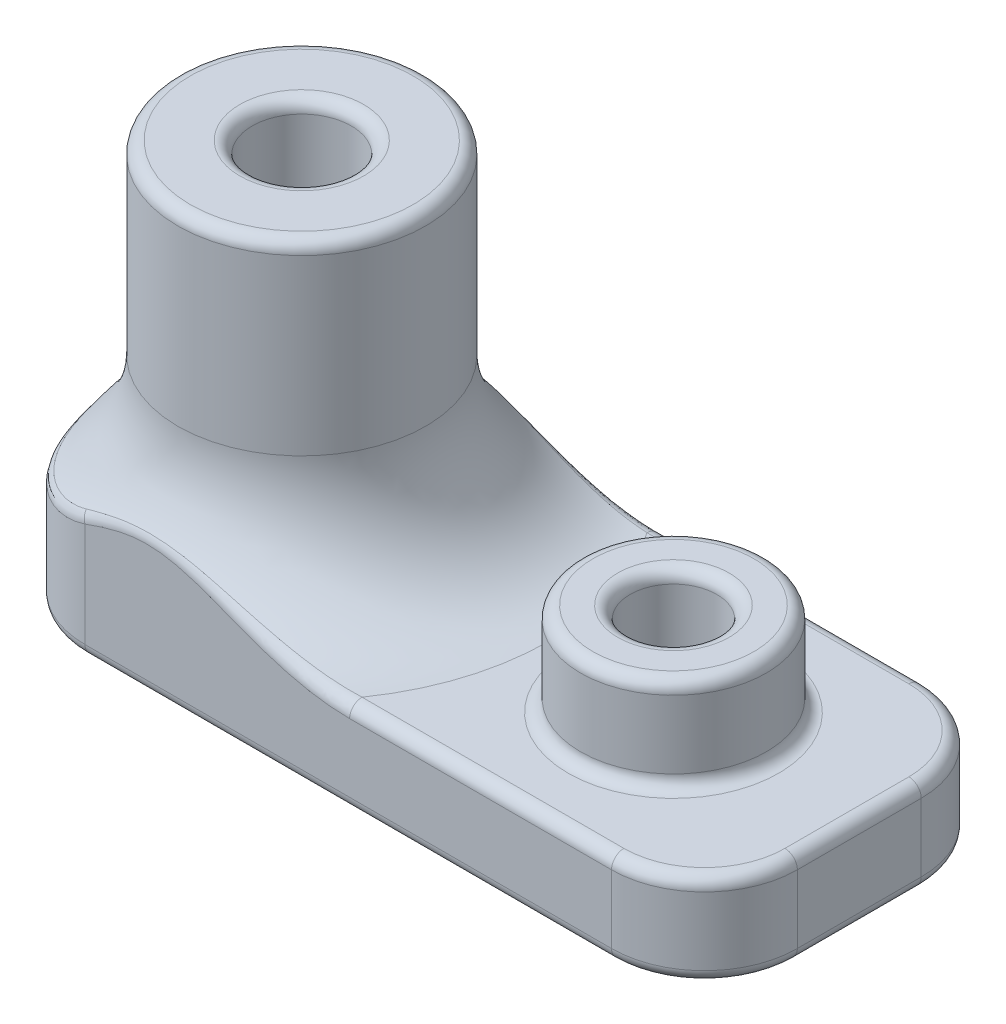
from build123d import *

# Parameters (mm, degrees)
SKETCH1_W           = 23
SKETCH1_H           = 10
BOSS_EXTRUDE1_DEPTH = 3
SKETCH2_R           = 4
BOSS_EXTRUDE2_DEPTH = 10
SKETCH3_R           = 1.6
CUT_EXTRUDE1_DEPTH  = 29.248893784
SKETCH4_R           = 1.4
CUT_EXTRUDE2_DEPTH  = 28
SKETCH5_R           = 2.85
CUT_EXTRUDE3_DEPTH  = 3
BOSS_EXTRUDE3_START = 3
SKETCH6_R           = 3
SKETCH6_R_2         = 1.4
BOSS_EXTRUDE3_DEPTH = 3
FILLET1_R           = 4
FILLET3_R           = 3
FILLET4_R           = 0.4
FILLET5_R           = 0.4


with BuildPart() as part:
    # Sketch1 → Boss-Extrude1 (new body)
    with BuildSketch(Plane(origin=(0, 0, 0), x_dir=(1, 0, 0), z_dir=(0, 1, 0))):
        with Locations((11.5, -5)):
            Rectangle(SKETCH1_W, SKETCH1_H)
    extrude(amount=BOSS_EXTRUDE1_DEPTH)

    # Sketch2 → Boss-Extrude2 (add)
    with BuildSketch(Plane(origin=(0, 3, 0), x_dir=(1, 0, 0), z_dir=(0, 1, 0))):
        with Locations(Location((5, -5, 0), (0, 0, 270))):
            Circle(SKETCH2_R)
    extrude(amount=BOSS_EXTRUDE2_DEPTH)

    # Sketch3 → Cut-Extrude1 (cut, through all)
    with BuildSketch(Plane(origin=(0, 13, 0), x_dir=(1, 0, 0), z_dir=(0, 1, 0))):
        with Locations(Location((5, -5, 0), (0, 0, 270))):
            Circle(SKETCH3_R)
    extrude(amount=-CUT_EXTRUDE1_DEPTH, mode=Mode.SUBTRACT)

    # Sketch4 → Cut-Extrude2 (cut, through all)
    with BuildSketch(Plane(origin=(0, 3, 0), x_dir=(1, 0, 0), z_dir=(0, 1, 0))):
        with Locations(Location((17, -5, 0), (0, 0, 270))):
            Circle(SKETCH4_R)
    extrude(amount=-CUT_EXTRUDE2_DEPTH, mode=Mode.SUBTRACT)

    # Sketch5 → Cut-Extrude3 (cut)
    with BuildSketch(Plane(origin=(0, 0, 0), x_dir=(-1, 0, 0), z_dir=(0, -1, 0))):
        with Locations(Location((-5, -5, 0), (0, 0, 90))):
            Circle(SKETCH5_R)
    extrude(amount=-CUT_EXTRUDE3_DEPTH, mode=Mode.SUBTRACT)

    # Sketch6 → Boss-Extrude3 (add)
    with BuildSketch(Plane(origin=(0, 3, 0), x_dir=(1, 0, 0), z_dir=(0, 1, 0)).offset(BOSS_EXTRUDE3_START)):
        with Locations(Location((17, -5, 0), (0, 0, 270))):
            Circle(SKETCH6_R)
        with Locations(Location((17, -5, 0), (0, 0, 270))):
            Circle(SKETCH6_R_2, mode=Mode.SUBTRACT)
    extrude(amount=-BOSS_EXTRUDE3_DEPTH)

    # Fillet1
    # the kernel refuses this fillet: 4 mm, written as the material it adds along each edge
    with BuildSketch(Plane(origin=(5, 3, 5), x_dir=(0, 0, 1), z_dir=(-1, 0, 0))) as fillet1_piece_1_section:
        with BuildLine():
            CenterArc((4 + FILLET1_R, FILLET1_R), FILLET1_R, 180, 90)
            Line((4, FILLET1_R), (4, 0))
            Line((4, 0), (4 + FILLET1_R, 0))
        make_face()
    fillet1_piece_1 = revolve(axis=Axis((5, 3, 5), (0, 1, 0)), mode=Mode.PRIVATE)
    fillet1_piece_1 = split(fillet1_piece_1, bisect_by=Plane(origin=(11.021245553, 3.091555609, 0), z_dir=(0, 0, 1)), keep=Keep.TOP, mode=Mode.PRIVATE)
    fillet1_piece_1 = split(fillet1_piece_1, bisect_by=Plane(origin=(0, 3.091555609, 8.476367741), z_dir=(1, 0, 0)), keep=Keep.TOP, mode=Mode.PRIVATE)
    fillet1_piece_1 = split(fillet1_piece_1, bisect_by=Plane(origin=(11.021245553, 3.091555609, 10), z_dir=(0, 0, -1)), keep=Keep.TOP, mode=Mode.PRIVATE)
    add(fillet1_piece_1)

    # Fillet3
    fillet3_edges = [part.edges().sort_by_distance(p)[0] for p in [
        (23, 1.5, 10),
        (23, 1.5, 0),
        (0, 1.554679658, 10),
        (0, 1.554679658, 0),
    ]]
    fillet(fillet3_edges, radius=FILLET3_R)

    # Fillet4
    fillet4_edges = [part.edges().sort_by_distance(p)[0] for p in [
        (17, 0, 3.6),
        (5, 0, 7.85),
        (17, 3, 2),
        (15.622498999, 3, 10),
        (8.106052264, 3.604131179, 10),
        (23, 0, 5),
        (23, 3, 5),
        (0, 0, 5),
        (11.5, 0, 0),
        (11.5, 0, 10),
        (0.878679656, 0, 0.878679656),
        (0.878679656, 0, 9.121320344),
        (22.121320344, 0, 0.878679656),
        (22.121320344, 0, 9.121320344),
        (15.622498999, 3, 0),
        (22.121320344, 3, 0.878679656),
        (22.121320344, 3, 9.121320344),
        (7.136585222, 3.92869257, 0),
        (0, 4.354248689, 4.999999996),
        (0.878679656, 3.640793062, 0.878679656),
        (0.878679656, 3.640793062, 9.121320344),
    ]]
    fillet(fillet4_edges, radius=FILLET4_R)

    # Fillet5
    fillet5_edges = [part.edges().sort_by_distance(p)[0] for p in [
        (5, 13, 1),
        (5, 13, 3.4),
        (17, 6, 2),
        (17, 6, 3.6),
    ]]
    fillet(fillet5_edges, radius=FILLET5_R)


solid = part.part
